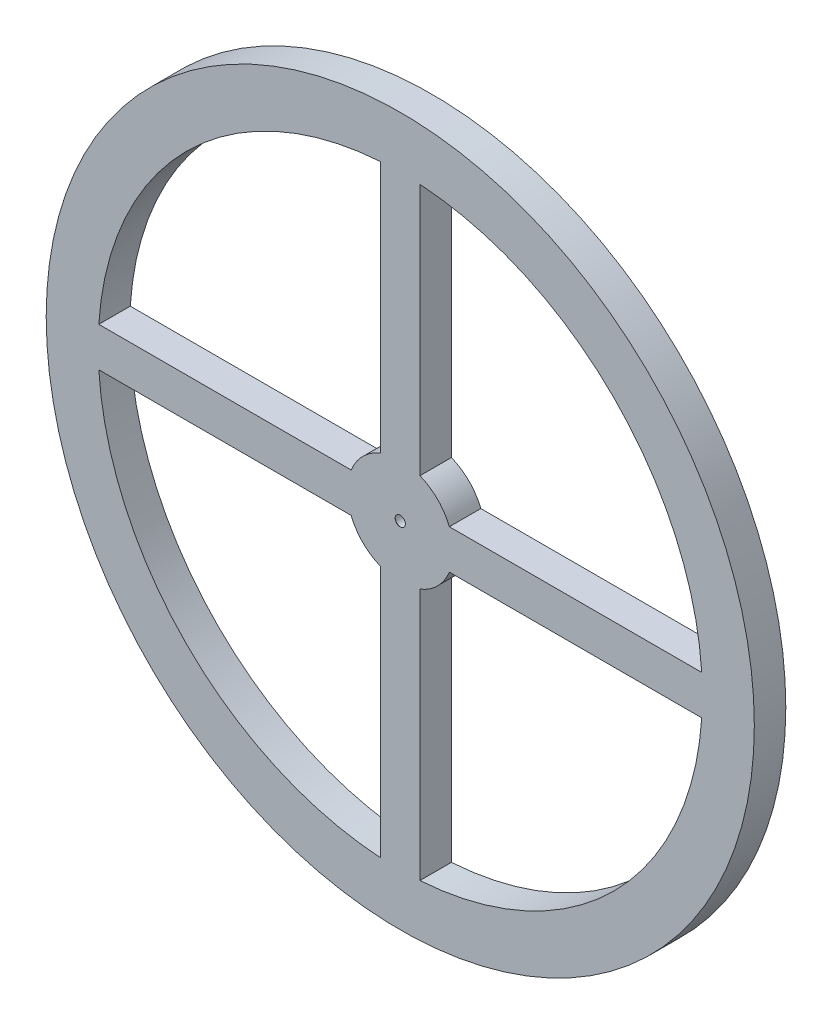
from build123d import *

# Parameters (mm, degrees)
SKETCH1_R           = 45
BOSS_EXTRUDE1_DEPTH = 4
CUT_EXTRUDE1_DEPTH  = 64.765194268


# Read off the part's stored shape, not the designer's step: Cavity1
with BuildPart() as part:
    # Sketch1 → Boss-Extrude1 (new body)
    with BuildSketch(Plane.XY):
        Circle(SKETCH1_R)
    extrude(amount=BOSS_EXTRUDE1_DEPTH)

    # Cavity1 outline → Cavity1 (revolve, cut)
    with BuildSketch(Plane.XZ):
        Polygon((0.75, 0), (0.75, 3.9), (0.65, 4), (0, 4), (0, 0), align=None)
    revolve(axis=Axis((0, 0, 0), (0, 0, 1)), mode=Mode.SUBTRACT)

    # Sketch2 → Cut-Extrude1 (cut, through all)
    with BuildSketch(Plane.XY.offset(4)):
        with BuildLine():
            Line((2.5, 6.241391614), (2.5, 38.313254027))
            ThreePointArc((2.5, 38.313254027), (27.149175256, 27.149175256), (38.313254027, 2.5))
            Line((38.313254027, 2.5), (6.241391614, 2.5))
            ThreePointArc((6.241391614, 2.5), (4.754207047, 4.754207047), (2.5, 6.241391614))
        make_face()
        with BuildLine():
            Line((-2.5, -38.313254027), (-2.5, -6.241391614))
            ThreePointArc((-2.5, -6.241391614), (-4.754207047, -4.754207047), (-6.241391614, -2.5))
            Line((-6.241391614, -2.5), (-38.313254027, -2.5))
            ThreePointArc((-38.313254027, -2.5), (-27.149175256, -27.149175256), (-2.5, -38.313254027))
        make_face()
        with BuildLine():
            Line((2.5, -38.313254027), (2.5, -6.241391614))
            ThreePointArc((2.5, -6.241391614), (4.754207047, -4.754207047), (6.241391614, -2.5))
            Line((6.241391614, -2.5), (38.313254027, -2.5))
            ThreePointArc((38.313254027, -2.5), (27.149175256, -27.149175256), (2.5, -38.313254027))
        make_face()
        with BuildLine():
            Line((-2.5, 6.241391614), (-2.5, 38.313254027))
            ThreePointArc((-2.5, 38.313254027), (-27.149175256, 27.149175256), (-38.313254027, 2.5))
            Line((-38.313254027, 2.5), (-6.241391614, 2.5))
            ThreePointArc((-6.241391614, 2.5), (-4.754207047, 4.754207047), (-2.5, 6.241391614))
        make_face()
    extrude(amount=-CUT_EXTRUDE1_DEPTH, mode=Mode.SUBTRACT)


solid = part.part
